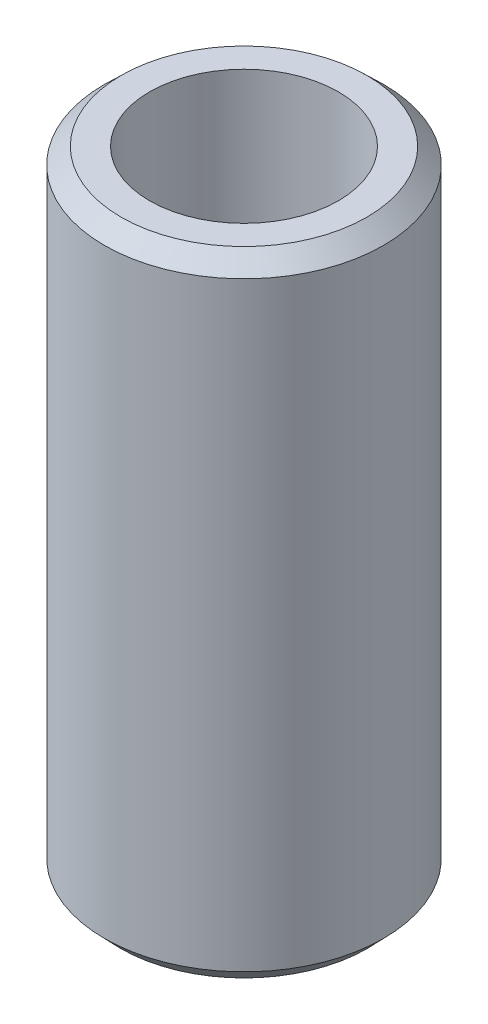
from build123d import *
from OCP.BRepFilletAPI import BRepFilletAPI_MakeChamfer

# Parameters (mm, degrees)
SKETCH1_R           = 22.5
BOSS_EXTRUDE1_DEPTH = 102.063704965
SKETCH2_R           = 15.222713854
CUT_EXTRUDE1_DEPTH  = 107.90883907
CHAMFER1_SIZE       = 2.596340104
CHAMFER1_SIZE2      = 2.693942943


with BuildPart() as part:
    # Sketch1 → Boss-Extrude1 (new body)
    with BuildSketch(Plane(origin=(0, 0, 0), x_dir=(1, 0, 0), z_dir=(0, 1, 0))):
        Circle(SKETCH1_R)
    extrude(amount=BOSS_EXTRUDE1_DEPTH)

    # Sketch2 → Cut-Extrude1 (cut, through all)
    with BuildSketch(Plane(origin=(0, 0, 0), x_dir=(1, 0, 0), z_dir=(0, 1, 0))):
        Circle(SKETCH2_R)
    extrude(amount=CUT_EXTRUDE1_DEPTH, mode=Mode.SUBTRACT)

    # Chamfer1: one chamfer whose edges measure the first distance from different faces: ONE call of the kernel's chamfer builder (chamfer() names one face for all edges)
    chamfer1_edges_1 = [part.edges().sort_by_distance(p)[0] for p in [
        (-22.5, 102.063704965, 0),
    ]]
    chamfer1_side_1 = [part.faces().sort_by_distance(p)[0] for p in [
        (-22.5, 51.031852483, 0),
    ]]
    chamfer1_edges_2 = [part.edges().sort_by_distance(p)[0] for p in [
        (-22.5, 0, 0),
    ]]
    chamfer1_side_2 = [part.faces().sort_by_distance(p)[0] for p in [
        (-21.863603897, 0, 0),
    ]]
    chamfer1 = BRepFilletAPI_MakeChamfer(part.part.solid().wrapped)
    for e in chamfer1_edges_1:
        chamfer1.Add(CHAMFER1_SIZE, CHAMFER1_SIZE2, e.wrapped, chamfer1_side_1[0].wrapped)  # the first distance lies on this face
    for e in chamfer1_edges_2:
        chamfer1.Add(CHAMFER1_SIZE, CHAMFER1_SIZE2, e.wrapped, chamfer1_side_2[0].wrapped)  # the first distance lies on this face
    add(Compound.cast(chamfer1.Shape()), mode=Mode.REPLACE)


solid = part.part
